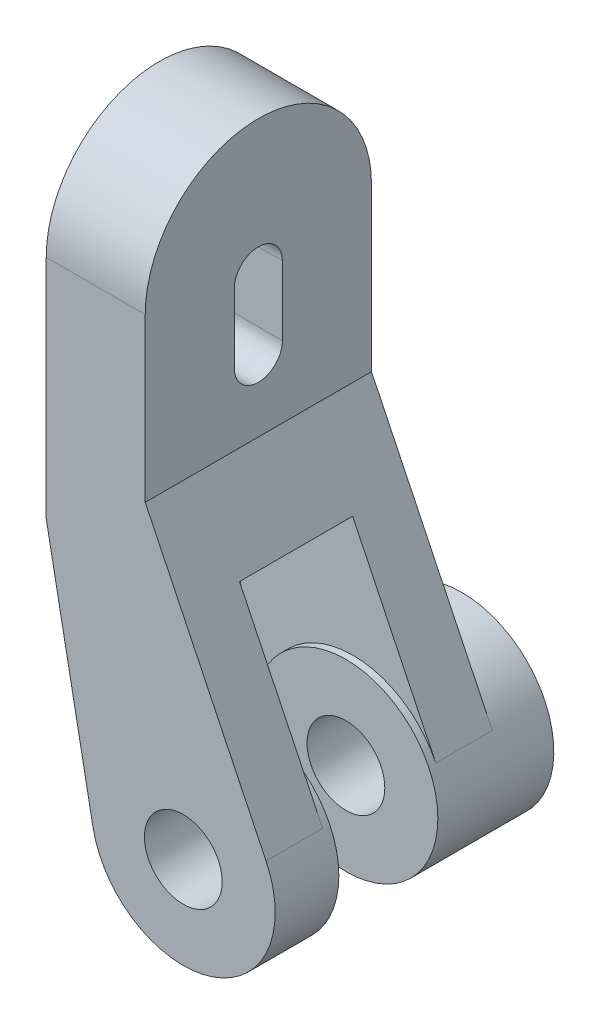
from build123d import *

# Parameters (mm, degrees)
BOSS_EXTRU_1_DEPTH      = 7
D_GAGEMENT_M31_DEPTH    = 7
BOSS_EXTRU_3_DEPTH      = 7
BOSS_EXTRU_4_DEPTH      = 16
ESQUISSE8_R             = 15
ENL_V_MAT_EXTRU_1_DEPTH = 4
ESQUISSE9_R             = 6.5
BOSS_EXTRU_5_DEPTH      = 0.5
D_GAGEMENT_M51_D        = 5.5
ESQUISSE12_R            = 6.5
BOSS_EXTRU_6_DEPTH      = 3.7


# Read off the part's stored shape, not the designer's step: Dégagement M31
with BuildPart() as part:
    # Esquisse1 → Boss.-Extru.1 (new body)
    with BuildSketch(Plane(origin=(0, 0, 0), x_dir=(0, 0, -1), z_dir=(1, 0, 0))):
        with BuildLine():
            Line((8, 4), (8, -4))
            ThreePointArc((8, -4), (0, -12), (-8, -4))
            Line((-8, -4), (-8, 4))
            ThreePointArc((-8, 4), (0, 12), (8, 4))
        make_face()
    extrude(amount=BOSS_EXTRU_1_DEPTH)

    # Dégagement M31 outline → Dégagement M31 (cut)
    with BuildSketch(Plane.YZ):
        with BuildLine():
            Line((-2.45, -1.7), (2.45, -1.7))
            ThreePointArc((2.45, -1.7), (4.15, 0), (2.45, 1.7))
            Line((2.45, 1.7), (-2.45, 1.7))
            ThreePointArc((-2.45, 1.7), (-4.15, 0), (-2.45, -1.7))
        make_face()
    extrude(amount=D_GAGEMENT_M31_DEPTH, mode=Mode.SUBTRACT)

    # Esquisse6 → Boss.-Extru.3 (add, through all)
    with BuildSketch(Plane(origin=(7, 0, 0), x_dir=(0, 0, -1), z_dir=(1, 0, 0))):
        with BuildLine():
            ThreePointArc((-5e-09, -12), (-5.656854251, -9.656854248), (-8, -4))
            Line((-8, -4), (-8, -12))
            Line((-8, -12), (-5e-09, -12))
        make_face()
        with BuildLine():
            ThreePointArc((8, -4), (5.656854248, -9.656854251), (-5e-09, -12))
            Line((-5e-09, -12), (8, -12))
            Line((8, -12), (8, -4))
        make_face()
    extrude(amount=-BOSS_EXTRU_3_DEPTH)

    # Esquisse7 → Boss.-Extru.4 (add, through all)
    with BuildSketch(Plane.XY.offset(8)):
        with BuildLine():
            Line((3.307940197, -29.244206061), (0, -12))
            Line((0, -12), (7, -12))
            Line((7, -12), (7, -7.5))
            Line((7, -7.5), (15.544704758, -25.192887251))
            ThreePointArc((15.544704758, -25.192887251), (11.734497019, -34.190248899), (3.307940197, -29.244206061))
        make_face()
    extrude(amount=-BOSS_EXTRU_4_DEPTH)

    # Esquisse8 → Enlèv. mat.-Extru.1 (cut, symmetric)
    with BuildSketch(Plane.XY):
        with Locations((9.69154802, -28.01964444)):
            Circle(ESQUISSE8_R)
    extrude(amount=ENL_V_MAT_EXTRU_1_DEPTH, both=True, mode=Mode.SUBTRACT)

    # Esquisse9 → Boss.-Extru.5 (add)
    with BuildSketch(Plane(origin=(0, 0, 4), x_dir=(-1, 0, 0), z_dir=(0, 0, -1))):
        with Locations(Location((-9.69154802, -28.01964444, 0), (0, 0, 154.221977628))):
            Circle(ESQUISSE9_R)
    boss_extru_5 = extrude(amount=BOSS_EXTRU_5_DEPTH)

    # Symétrie1: Boss.-Extru.5 across plane
    add(boss_extru_5.mirror(Plane.XY))

    # Dégagement M51 (through all)
    with Locations(Plane.XY.offset(8)):
        with Locations((9.69154802, -28.01964444)):
            Hole(D_GAGEMENT_M51_D / 2)

    # Esquisse12 → Boss.-Extru.6 (add)
    with BuildSketch(Plane(origin=(0, 0, -8), x_dir=(-1, 0, 0), z_dir=(0, 0, -1))):
        with Locations(Location((-9.69154802, -28.01964444, 0), (0, 0, 90))):
            Circle(ESQUISSE12_R)
        Polygon((-4.668600678, -28.01964444), (-7.180074349, -23.66964444), (-12.203021691, -23.66964444), (-14.714495362, -28.01964444), (-12.203021691, -32.36964444), (-7.180074349, -32.36964444), align=None, mode=Mode.SUBTRACT)
    extrude(amount=BOSS_EXTRU_6_DEPTH)


solid = part.part
